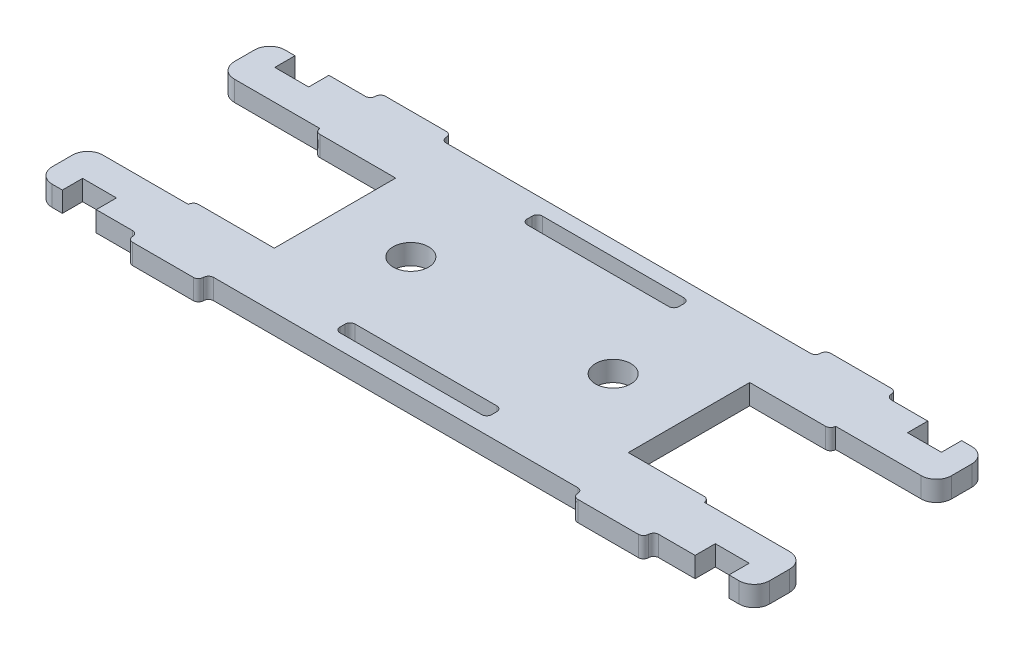
from build123d import *

# Parameters (mm, degrees)
SCHIZZO1_W                   = 30
SCHIZZO1_H                   = 3
SCHIZZO1_R                   = 3.5
ESTRUSIONE_ESTRUSIONE1_DEPTH = 4
RACCORDO1_START              = -1
RACCORDO1_DEPTH              = 6
RACCORDO1_2_DEPTH            = 4
RACCORDO2_R                  = 3
RACCORDO3_R                  = 1
RACCORDO4_R                  = 1


with BuildPart() as part:
    # Schizzo1 → Estrusione-Estrusione1 (new body)
    with BuildSketch(Plane(origin=(0, 0, 0), x_dir=(1, 0, 0), z_dir=(0, 1, 0))):
        Polygon((-65.9, 19), (-65.9, 23), (-70.9, 23), (-70.9, 13), (-51, 13), (-51, 12), (-35, 12), (-35, -12), (-51, -12), (-51, -13), (-70.9, -13), (-70.9, -23), (-65.9, -23), (-65.9, -19), (-59.2, -19), (-59.2, -23), (-51, -23), (-51, -25), (-37, -25), (-37, -23), (37, -23), (37, -25), (51, -25), (51, -23), (59.2, -23), (59.2, -19), (65.9, -19), (65.9, -23), (70.9, -23), (70.9, -13), (51, -13), (51, -12), (35, -12), (35, 12), (51, 12), (51, 13), (70.9, 13), (70.9, 23), (65.9, 23), (65.9, 19), (59.2, 19), (59.2, 23), (51, 23), (51, 25), (37, 25), (37, 23), (-37, 23), (-37, 25), (-51, 25), (-51, 23), (-59.2, 23), (-59.2, 19), align=None)
        with Locations((0, -18.5)):
            Rectangle(SCHIZZO1_W, SCHIZZO1_H, mode=Mode.SUBTRACT)
        with Locations(Location((20, 0, 0), (0, 0, 270))):
            Circle(SCHIZZO1_R, mode=Mode.SUBTRACT)
        with Locations((0, 18.5)):
            Rectangle(SCHIZZO1_W, SCHIZZO1_H, mode=Mode.SUBTRACT)
        with Locations(Location((-20, 0, 0), (0, 0, 270))):
            Circle(SCHIZZO1_R, mode=Mode.SUBTRACT)
    extrude(amount=ESTRUSIONE_ESTRUSIONE1_DEPTH)

    # Raccordo1: read off the stored shape, not the designer's step
    # Raccordo1 outline → Raccordo1 (cut)
    with BuildSketch(Plane(origin=(0, 0, 0), x_dir=(1, 0, 0), z_dir=(0, 1, 0)).offset(RACCORDO1_START)):
        with BuildLine():
            Line((51, -25), (51, -24))
            ThreePointArc((51, -24), (50.707106781, -24.707106781), (50, -25))
            Line((50, -25), (51, -25))
        make_face()
        with BuildLine():
            Line((-51, -25), (-50, -25))
            ThreePointArc((-50, -25), (-50.707106781, -24.707106781), (-51, -24))
            Line((-51, -24), (-51, -25))
        make_face()
        with BuildLine():
            Line((-37, -25), (-37, -24))
            ThreePointArc((-37, -24), (-37.292893219, -24.707106781), (-38, -25))
            Line((-38, -25), (-37, -25))
        make_face()
        with BuildLine():
            Line((37, -25), (38, -25))
            ThreePointArc((38, -25), (37.292893219, -24.707106781), (37, -24))
            Line((37, -24), (37, -25))
        make_face()
        with BuildLine():
            Line((37, 25), (37, 24))
            ThreePointArc((37, 24), (37.292893219, 24.707106781), (38, 25))
            Line((38, 25), (37, 25))
        make_face()
        with BuildLine():
            ThreePointArc((-51, 24), (-50.707106781, 24.707106781), (-50, 25))
            Line((-50, 25), (-51, 25))
            Line((-51, 25), (-51, 24))
        make_face()
        with BuildLine():
            ThreePointArc((-38, 25), (-37.292893219, 24.707106781), (-37, 24))
            Line((-37, 24), (-37, 25))
            Line((-37, 25), (-38, 25))
        make_face()
        with BuildLine():
            Line((51, 25), (50, 25))
            ThreePointArc((50, 25), (50.707106781, 24.707106781), (51, 24))
            Line((51, 24), (51, 25))
        make_face()
    extrude(amount=RACCORDO1_DEPTH, mode=Mode.SUBTRACT)

    # Raccordo1 2 outline → Raccordo1 2 (add)
    with BuildSketch(Plane(origin=(0, 0, 0), x_dir=(1, 0, 0), z_dir=(0, 1, 0))):
        with BuildLine():
            Line((51, -23), (51, -24))
            ThreePointArc((51, -24), (51.292893219, -23.292893219), (52, -23))
            Line((52, -23), (51, -23))
        make_face()
        with BuildLine():
            ThreePointArc((-52, -23), (-51.292893219, -23.292893219), (-51, -24))
            Line((-51, -24), (-51, -23))
            Line((-51, -23), (-52, -23))
        make_face()
        with BuildLine():
            ThreePointArc((-37, -24), (-36.707106781, -23.292893219), (-36, -23))
            Line((-36, -23), (-37, -23))
            Line((-37, -23), (-37, -24))
        make_face()
        with BuildLine():
            ThreePointArc((36, -23), (36.707106781, -23.292893219), (37, -24))
            Line((37, -24), (37, -23))
            Line((37, -23), (36, -23))
        make_face()
        with BuildLine():
            Line((37, 23), (37, 24))
            ThreePointArc((37, 24), (36.707106781, 23.292893219), (36, 23))
            Line((36, 23), (37, 23))
        make_face()
        with BuildLine():
            Line((-51, 23), (-51, 24))
            ThreePointArc((-51, 24), (-51.292893219, 23.292893219), (-52, 23))
            Line((-52, 23), (-51, 23))
        make_face()
        with BuildLine():
            Line((-37, 23), (-36, 23))
            ThreePointArc((-36, 23), (-36.707106781, 23.292893219), (-37, 24))
            Line((-37, 24), (-37, 23))
        make_face()
        with BuildLine():
            ThreePointArc((52, 23), (51.292893219, 23.292893219), (51, 24))
            Line((51, 24), (51, 23))
            Line((51, 23), (52, 23))
        make_face()
    extrude(amount=RACCORDO1_2_DEPTH)

    # Raccordo2
    raccordo2_edges = [part.edges().sort_by_distance(p)[0] for p in [
        (70.9, 2, 13),
        (70.9, 2, 23),
        (-70.9, 2, 23),
        (-70.9, 2, 13),
        (-70.9, 2, -13),
        (-70.9, 2, -23),
        (70.9, 2, -23),
        (70.9, 2, -13),
    ]]
    fillet(raccordo2_edges, radius=RACCORDO2_R)

    # Raccordo3
    raccordo3_edges = [part.edges().sort_by_distance(p)[0] for p in [
        (51, 2, -12),
        (51, 2, 12),
        (-51, 2, 12),
        (-51, 2, -12),
    ]]
    fillet(raccordo3_edges, radius=RACCORDO3_R - 0.0001)  # a hair under: the kernel refuses the full size

    # Raccordo4
    raccordo4_edges = [part.edges().sort_by_distance(p)[0] for p in [
        (15, 2, 17),
        (-15, 2, 17),
        (-15, 2, 20),
        (15, 2, 20),
        (15, 2, -20),
        (-15, 2, -20),
        (-15, 2, -17),
        (15, 2, -17),
    ]]
    fillet(raccordo4_edges, radius=RACCORDO4_R)


solid = part.part
